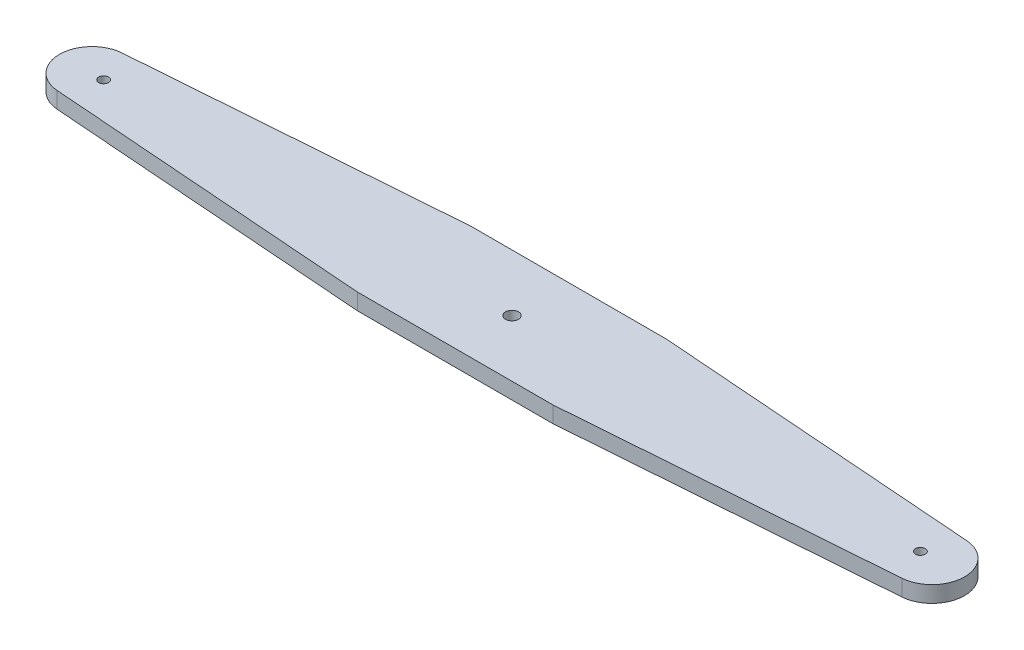
from build123d import *

# Parameters (mm, degrees)
SKETCH1_R           = 3
SKETCH1_R_2         = 4
BOSS_EXTRUDE1_DEPTH = 10


with BuildPart() as part:
    # Sketch1 → Boss-Extrude1 (new body)
    with BuildSketch(Plane(origin=(0, 0, 0), x_dir=(1, 0, 0), z_dir=(0, 1, 0))):
        with BuildLine():
            Line((7.402097467, -69.909373862), (127.402097467, -69.909373862))
            Line((127.402097467, -69.909373862), (326.840218217, -84.890561787))
            ThreePointArc((326.840218217, -84.890561787), (345.342099425, -104.834373862), (326.840218217, -124.778185937))
            Line((326.840218217, -124.778185937), (127.402097467, -139.759373862))
            Line((127.402097467, -139.759373862), (7.402097467, -139.759373862))
            Line((7.402097467, -139.759373862), (-192.036023283, -124.778185937))
            ThreePointArc((-192.036023283, -124.778185937), (-210.53790449, -104.834373862), (-192.036023283, -84.890561787))
            Line((-192.036023283, -84.890561787), (7.402097467, -69.909373862))
        make_face()
        with Locations((-183.422902533, -104.834373862)):
            Circle(SKETCH1_R, mode=Mode.SUBTRACT)
        with Locations((318.227097467, -104.834373862)):
            Circle(SKETCH1_R, mode=Mode.SUBTRACT)
        with Locations((67.402097467, -104.834373862)):
            Circle(SKETCH1_R_2, mode=Mode.SUBTRACT)
    extrude(amount=BOSS_EXTRUDE1_DEPTH)


solid = part.part
